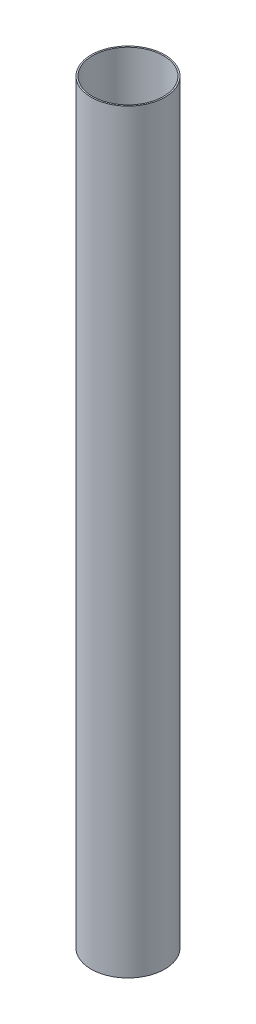
from build123d import *

# Parameters (mm, degrees)
SKETCH2_R           = 39.624
SKETCH2_R_2         = 38.1
BOSS_EXTRUDE1_DEPTH = 812.8


with BuildPart() as part:
    # Sketch2 → Boss-Extrude1 (new body)
    with BuildSketch(Plane(origin=(0, 0, 0), x_dir=(1, 0, 0), z_dir=(0, 1, 0))):
        Circle(SKETCH2_R)
        Circle(SKETCH2_R_2, mode=Mode.SUBTRACT)
    extrude(amount=BOSS_EXTRUDE1_DEPTH)


solid = part.part
